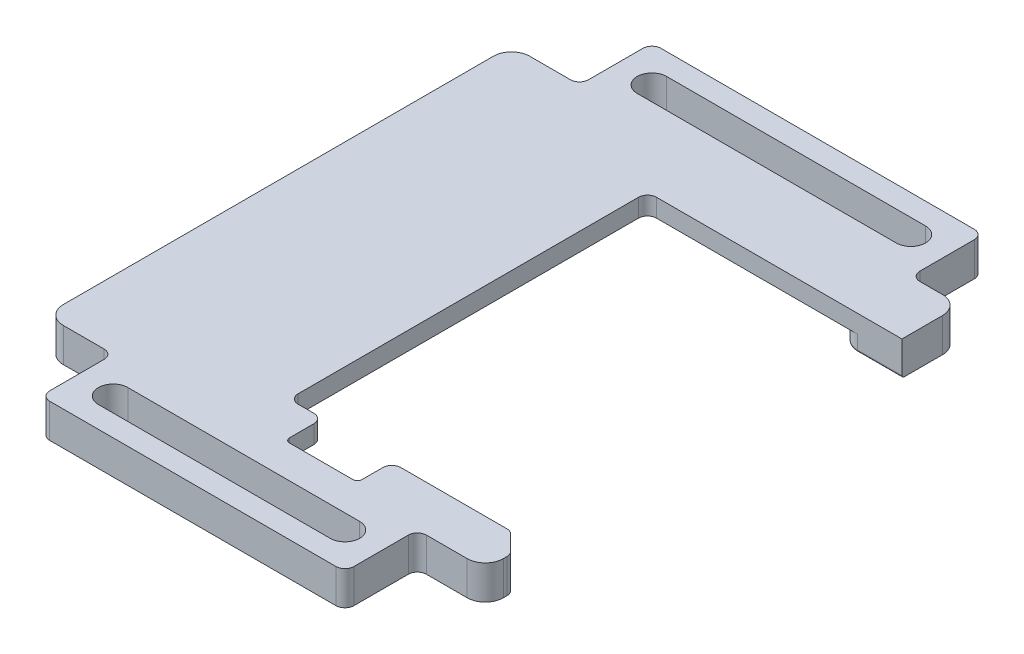
from build123d import *

# Parameters (mm, degrees)
SKETCH1_R           = 2.09
BOSS_EXTRUDE1_DEPTH = 7.5
CUT_EXTRUDE1_DEPTH  = 3.5
BOSS_EXTRUDE2_START = 5.5
SKETCH1_2_R         = 2.09
BOSS_EXTRUDE2_DEPTH = 2
SKETCH3_W           = 67.2
SKETCH3_H           = 16
SKETCH3_W_2         = 73.2
BOSS_EXTRUDE3_DEPTH = 7.5
FILLET11_R          = 4
FILLET10_R          = 4
FILLET7_R           = 0.5
FILLET8_R           = 2
CUT_EXTRUDE2_DEPTH  = 1
CHAMFER1_SIZE       = 4.5
FILLET12_R          = 2


with BuildPart() as part:
    # Sketch1 → Boss-Extrude1 (new body)
    with BuildSketch(Plane(origin=(0, 0, 0), x_dir=(1, 0, 0), z_dir=(0, 1, 0))):
        with BuildLine():
            Line((-10, 98.415579118), (29.043283521, 98.415579118))
            Line((29.043283521, 98.415579118), (75.120827307, 98.415579118))
            Line((75.120827307, 98.415579118), (81.2, 98.415579118))
            ThreePointArc((81.2, 98.415579118), (84.028427125, 97.244006243), (85.2, 94.415579118))
            Line((85.2, 94.415579118), (85.2, 85.44))
            Line((85.2, 85.44), (31, 85.44))
            ThreePointArc((31, 85.44), (29.585786438, 84.854213562), (29, 83.44))
            Line((29, 83.44), (29, 8.281912492))
            ThreePointArc((29, 8.281912492), (29.585786438, 6.86769893), (31, 6.281912492))
            Line((31, 6.281912492), (34.469079788, 6.281912492))
            ThreePointArc((34.469079788, 6.281912492), (35.88329335, 5.696126054), (36.469079788, 4.281912492))
            Line((36.469079788, 4.281912492), (36.469079788, -1.086368588))
            ThreePointArc((36.469079788, -1.086368588), (36.761973007, -1.793475369), (37.469079788, -2.086368588))
            Line((37.469079788, -2.086368588), (51.469079788, -2.086368588))
            ThreePointArc((51.469079788, -2.086368588), (52.176186569, -1.793475369), (52.469079788, -1.086368588))
            Line((52.469079788, -1.086368588), (52.469079788, 3.51))
            ThreePointArc((52.469079788, 3.51), (53.054866225, 4.924213562), (54.469079788, 5.51))
            Line((54.469079788, 5.51), (83.2, 5.51))
            Line((83.2, 5.51), (83.2, -0.586368588))
            ThreePointArc((83.2, -0.586368588), (82.028427125, -3.414795713), (79.2, -4.586368588))
            Line((79.2, -4.586368588), (-10, -4.586368588))
            ThreePointArc((-10, -4.586368588), (-12.828427125, -3.414795713), (-14, -0.586368588))
            Line((-14, -0.586368588), (-14, 94.415579118))
            ThreePointArc((-14, 94.415579118), (-12.828427125, 97.244006243), (-10, 98.415579118))
        make_face()
        with Locations(Location((0, 0, 0), (0, 0, 270))):
            Circle(SKETCH1_R, mode=Mode.SUBTRACT)
        with Locations(Location((0, 91, 0), (0, 0, 270))):
            Circle(SKETCH1_R, mode=Mode.SUBTRACT)
        with Locations(Location((77.7, 91, 0), (0, 0, 270))):
            Circle(SKETCH1_R, mode=Mode.SUBTRACT)
        with Locations(Location((77.7, 0, 0), (0, 0, 270))):
            Circle(SKETCH1_R, mode=Mode.SUBTRACT)
    extrude(amount=BOSS_EXTRUDE1_DEPTH)

    # Sketch2 → Cut-Extrude1 (cut)
    with BuildSketch(Plane.XZ):
        with BuildLine():
            Line((-5.752225656, 0), (-14, 0))
            Line((-14, 0), (-14, -91))
            Line((-14, -91), (-6.873863542, -91))
            ThreePointArc((-6.873863542, -91), (-5.23069587, -90.50998008), (-4.124318125, -89.2))
            ThreePointArc((-4.124318125, -89.2), (0.919393397, -86.594921592), (4.5, -91))
            Line((4.5, -91), (4.5, -93.915579118))
            ThreePointArc((4.5, -93.915579118), (5.085786438, -95.32979268), (6.5, -95.915579118))
            Line((6.5, -95.915579118), (69.376050786, -95.915579118))
            ThreePointArc((69.376050786, -95.915579118), (70.790264348, -95.32979268), (71.376050786, -93.915579118))
            Line((71.376050786, -93.915579118), (71.376050786, 0.086368588))
            ThreePointArc((71.376050786, 0.086368588), (70.790264348, 1.50058215), (69.376050786, 2.086368588))
            Line((69.376050786, 2.086368588), (6.089387528, 2.086368588))
            ThreePointArc((6.089387528, 2.086368588), (4.665181058, 1.490518128), (4.089588668, 0.05800452))
            ThreePointArc((4.089588668, 0.05800452), (4.037618007, -0.652488181), (3.863153191, -1.34318555))
            ThreePointArc((3.863153191, -1.34318555), (0, -4.09), (-3.863153191, -1.34318555))
            ThreePointArc((-3.863153191, -1.34318555), (-4.593266835, -0.370026243), (-5.752225656, 0))
        make_face()
    extrude(amount=-CUT_EXTRUDE1_DEPTH, mode=Mode.SUBTRACT)

    # Sketch1<2> → Boss-Extrude2 (add)
    with BuildSketch(Plane(origin=(0, 0, 0), x_dir=(1, 0, 0), z_dir=(0, 1, 0)).offset(BOSS_EXTRUDE2_START)):
        with Locations(Location((0, 0, 0), (0, 0, 270))):
            Circle(SKETCH1_2_R)
        with Locations(Location((0, 91, 0), (0, 0, 270))):
            Circle(SKETCH1_2_R)
        with Locations(Location((77.7, 91, 0), (0, 0, 270))):
            Circle(SKETCH1_2_R)
        with Locations(Location((77.7, 0, 0), (0, 0, 270))):
            Circle(SKETCH1_2_R)
    extrude(amount=BOSS_EXTRUDE2_DEPTH)

    # Sketch3 → Boss-Extrude3 (add)
    # profile 1 of 2: a face of its own
    with BuildSketch(Plane(origin=(0, 7.5, 0), x_dir=(1, 0, 0), z_dir=(0, 1, 0))):
        with Locations((34.6, -12.586368588)):
            Rectangle(SKETCH3_W, SKETCH3_H)
        with BuildLine():
            Line((60.2, -15.836368588), (9, -15.836368588))
            ThreePointArc((9, -15.836368588), (5.75, -12.586368588), (9, -9.336368588))
            Line((9, -9.336368588), (60.2, -9.336368588))
            ThreePointArc((60.2, -9.336368588), (63.45, -12.586368588), (60.2, -15.836368588))
        make_face(mode=Mode.SUBTRACT)
    # profile 2 of 2: a face of its own
    with BuildSketch(Plane(origin=(0, 7.5, 0), x_dir=(1, 0, 0), z_dir=(0, 1, 0))):
        with Locations((37.6, 106.415579118)):
            Rectangle(SKETCH3_W_2, SKETCH3_H)
        with BuildLine():
            Line((9, 109.665579118), (66.2, 109.665579118))
            ThreePointArc((66.2, 109.665579118), (69.45, 106.415579118), (66.2, 103.165579118))
            Line((66.2, 103.165579118), (9, 103.165579118))
            ThreePointArc((9, 103.165579118), (5.75, 106.415579118), (9, 109.665579118))
        make_face(mode=Mode.SUBTRACT)
    extrude(amount=-BOSS_EXTRUDE3_DEPTH)

    # Fillet11
    fillet11_edges = [part.edges().sort_by_distance(p)[0] for p in [
        (71.376050786, 1.75, -5.51),
    ]]
    fillet(fillet11_edges, radius=FILLET11_R)

    # Fillet10
    fillet10_edges = [part.edges().sort_by_distance(p)[0] for p in [
        (71.376050786, 1.75, -85.44),
    ]]
    fillet(fillet10_edges, radius=FILLET10_R)

    # Fillet7
    fillet7_edges = [part.edges().sort_by_distance(p)[0] for p in [
        (70.790264348, 0, 1.50058215),
        (4.665181058, 0, 1.490518128),
        (0.709684197, 0, -4.027958334),
        (-4.593266835, 0, -0.370026243),
        (-9.876112828, 0, 0),
        (-10.436931771, 0, -91),
        (-5.23069587, 0, -90.50998008),
        (0.919393397, 0, -86.594921592),
        (4.5, 0, -92.457789559),
        (5.085786438, 0, -95.32979268),
        (37.938025393, 0, -95.915579118),
        (70.790264348, 0, -95.32979268),
        (71.376050786, 0, -91.677789559),
        (71.376050786, 0, -0.711815706),
        (72.547623661, 0, -4.338427125),
        (80.288025393, 0, -85.44),
        (72.547623661, 0, -86.611572875),
        (37.732719157, 0, 2.086368588),
        (79.288025393, 0, -5.51),
    ]]
    fillet(fillet7_edges, radius=FILLET7_R)

    # Fillet8
    fillet8_edges = [part.edges().sort_by_distance(p)[0] for p in [
        (68.2, 3.75, 4.586368588),
        (1, 3.75, 4.586368588),
        (1, 3.75, 20.586368588),
        (68.2, 3.75, 20.586368588),
        (74.2, 3.75, -98.415579118),
        (74.2, 3.75, -114.415579118),
        (1, 3.75, -114.415579118),
        (1, 3.75, -98.415579118),
    ]]
    fillet(fillet8_edges, radius=FILLET8_R)

    # Sketch4 → Cut-Extrude2 (cut)
    # profile 1 of 3: a face of its own
    with BuildSketch(Plane.XZ.offset(-3.5)):
        Polygon((7.335777277, -15.119328993), (8.306830963, -15.119328993), (8.306830963, -18.619328993), (7.678625835, -18.619328993), (7.678625835, -15.702662326), (6.960677117, -15.702662326), align=None)
    # profile 2 of 3: a face of its own
    with BuildSketch(Plane.XZ.offset(-3.5)):
        with BuildLine():
            add(Edge.make_bspline(
                [(10.562339777, -15.029585403), (10.592747513, -15.030036814), (10.652537245, -15.03092441), (10.740596266, -15.040537791), (10.825421451, -15.05506093), (10.907344645, -15.075315643), (10.985776157, -15.102122035), (11.061286828, -15.134208827), (11.132977863, -15.173259037), (11.201763551, -15.217368255), (11.267617396, -15.267306142), (11.328956646, -15.324237912), (11.386901488, -15.386853563), (11.440197627, -15.45609973), (11.490025325, -15.531346546), (11.536220855, -15.612605943), (11.578430578, -15.700275632), (11.617127566, -15.794513819), (11.651730535, -15.896733094), (11.680876573, -16.008105956), (11.705874177, -16.12865784), (11.726973919, -16.258688817), (11.742921914, -16.398371729), (11.753671183, -16.547613779), (11.761047841, -16.706127249), (11.761649872, -16.814866186), (11.761959168, -16.870731236)],
                knots=[0, 0, 0, 0, 0.879237366, 1.728815576, 2.559023295, 3.367336655, 4.166867292, 4.954216142, 5.737608147, 6.525189134, 7.316157332, 8.124696809, 8.942788509, 9.781158001, 10.649253743, 11.551476218, 12.482711956, 13.461909668, 14.496590415, 15.601789533, 16.789733467, 18.056700938, 19.410929216, 20.8549011, 22.384193279, 24, 24, 24, 24], degree=3))
            add(Edge.make_bspline(
                [(11.761959168, -16.870731236), (11.761624903, -16.927295221), (11.760975431, -17.037198028), (11.753977833, -17.197161342), (11.741927638, -17.347486979), (11.726396478, -17.488159385), (11.705123037, -17.619104273), (11.68020888, -17.740660704), (11.650602781, -17.852784615), (11.614860001, -17.955223368), (11.576397247, -18.049627058), (11.534072061, -18.137125811), (11.488622167, -18.217956624), (11.441090047, -18.293338938), (11.388869815, -18.361050521), (11.334503179, -18.423393922), (11.275622916, -18.477994399), (11.214708114, -18.527665818), (11.149527218, -18.570591891), (11.08075242, -18.608134327), (11.007157586, -18.638585702), (10.930084224, -18.665070681), (10.848218603, -18.684084038), (10.762861557, -18.699170512), (10.673049422, -18.707508223), (10.611901702, -18.708542571), (10.580568944, -18.709072582)],
                knots=[0, 0, 0, 0, 1.643780988, 3.193836972, 4.651895693, 6.025988579, 7.305620092, 8.505800249, 9.631074763, 10.672816429, 11.65661981, 12.592235626, 13.49536222, 14.350718032, 15.179365177, 15.97804903, 16.751647189, 17.51006938, 18.259804725, 19.016521909, 19.783502495, 20.571750527, 21.382245291, 22.22305063, 23.089471752, 24, 24, 24, 24], degree=3))
            add(Edge.make_bspline(
                [(10.580568944, -18.709072582), (10.549237031, -18.708532348), (10.487858274, -18.707474036), (10.397803278, -18.699232507), (10.311993882, -18.684022923), (10.229480572, -18.66492471), (10.150837629, -18.638644302), (10.075687961, -18.607281844), (10.004609404, -18.569973654), (9.937405153, -18.526947567), (9.874304662, -18.477608488), (9.814327351, -18.422484155), (9.757605892, -18.361714292), (9.705003159, -18.294618228), (9.655657672, -18.222091554), (9.610084027, -18.143306052), (9.568309611, -18.058376431), (9.529027714, -17.967184309), (9.494896718, -17.867766422), (9.464521716, -17.759234984), (9.439639314, -17.640685293), (9.419627221, -17.512155435), (9.403649577, -17.373917708), (9.391764047, -17.225905386), (9.38472758, -17.068049531), (9.38408492, -16.959547338), (9.38375404, -16.903683961)],
                knots=[0, 0, 0, 0, 0.917216111, 1.796812873, 2.643793957, 3.46689424, 4.273913431, 5.068098542, 5.848489301, 6.620921603, 7.401012384, 8.190319798, 9.003608147, 9.831726257, 10.68377682, 11.569763213, 12.493818149, 13.453288342, 14.474581811, 15.568529029, 16.750744269, 18.018426408, 19.375425659, 20.823733699, 22.36466933, 24, 24, 24, 24], degree=3))
            add(Edge.make_bspline(
                [(9.38375404, -16.903683961), (9.384353398, -16.826066195), (9.385509866, -16.676301717), (9.400165487, -16.459935591), (9.42167622, -16.259942587), (9.453270392, -16.076657244), (9.492336149, -15.909400728), (9.542361885, -15.759274836), (9.599312546, -15.624202241), (9.647841826, -15.544184422), (9.671213976, -15.505647102)],
                knots=[0, 0, 0, 0, 1.288568992, 2.486310467, 3.599230591, 4.627010532, 5.572937695, 6.447898582, 7.252493626, 8, 8, 8, 8], degree=3))
            add(Edge.make_bspline(
                [(9.671213976, -15.505647102), (9.698389998, -15.46778805), (9.751524475, -15.393766145), (9.844431595, -15.296589219), (9.944248199, -15.213478753), (10.053024463, -15.146315613), (10.169040046, -15.093350754), (10.293290999, -15.055942271), (10.425318486, -15.034146346), (10.515983963, -15.03112842), (10.562339777, -15.029585403)],
                knots=[0, 0, 0, 0, 1.058512271, 2.069600068, 3.047294572, 4.004278952, 4.967380941, 5.939006123, 6.946246673, 8, 8, 8, 8], degree=3))
        make_face()
        with BuildLine():
            add(Edge.make_bspline(
                [(10.577764456, -15.657790531), (10.550275611, -15.659093448), (10.496382883, -15.661647856), (10.418181966, -15.683331177), (10.344443385, -15.716822237), (10.288352415, -15.75712349), (10.246368882, -15.795757074), (10.217034686, -15.830719212), (10.188746478, -15.869734438), (10.163760908, -15.914563308), (10.140168008, -15.963595069), (10.117110633, -16.017052295), (10.09820964, -16.076248011), (10.079639915, -16.140174108), (10.063371104, -16.21059797), (10.049741407, -16.288095237), (10.03756447, -16.373169879), (10.029070912, -16.465877621), (10.021152366, -16.566121467), (10.015475978, -16.674124722), (10.013102823, -16.789858249), (10.012348469, -16.869562212), (10.011959168, -16.910695179)],
                knots=[0, 0, 0, 0, 1.076674018, 2.110852608, 3.161083442, 4.239746716, 4.804137807, 5.395870207, 6.026861976, 6.692161227, 7.405688833, 8.16177676, 8.973626916, 9.841385931, 10.773283133, 11.807421078, 12.927755683, 14.143907515, 15.458935494, 16.872852025, 18.386167141, 20, 20, 20, 20], degree=3))
            add(Edge.make_bspline(
                [(10.011959168, -16.910695179), (10.01259991, -16.963984926), (10.01382858, -17.066171966), (10.020263779, -17.213120489), (10.033162602, -17.346855478), (10.049206133, -17.468283303), (10.071739927, -17.576616474), (10.097666516, -17.672879922), (10.129683548, -17.755846523), (10.166685398, -17.826716159), (10.207666614, -17.887004811), (10.252153527, -17.938250437), (10.298631517, -17.982626732), (10.348551312, -18.018673049), (10.40179382, -18.046297285), (10.457914563, -18.066167056), (10.516949205, -18.078330171), (10.557375519, -18.080016804), (10.577764456, -18.080867454)],
                knots=[0, 0, 0, 0, 1.771748488, 3.397459088, 4.888034009, 6.237357457, 7.467047327, 8.564189669, 9.548206622, 10.417051504, 11.216568818, 11.965764335, 12.669334354, 13.348544111, 14.005342236, 14.656555988, 15.322436492, 16, 16, 16, 16], degree=3))
            add(Edge.make_bspline(
                [(10.577764456, -18.080867454), (10.59745371, -18.080285376), (10.63600282, -18.07914574), (10.692216055, -18.067447524), (10.745375285, -18.048428766), (10.795320005, -18.021525398), (10.84222886, -17.987313648), (10.885872589, -17.945643177), (10.925922039, -17.896098627), (10.949255031, -17.859329243), (10.961278078, -17.840382679)],
                knots=[0, 0, 0, 0, 0.992283464, 1.942767638, 2.88273346, 3.832339453, 4.79467288, 5.803907806, 6.868395428, 8, 8, 8, 8], degree=3))
            add(Edge.make_bspline(
                [(10.961278078, -17.840382679), (10.975433191, -17.814492804), (11.005115316, -17.760203835), (11.039463521, -17.668593225), (11.068375926, -17.565271598), (11.09326041, -17.449917408), (11.110279879, -17.322075683), (11.124937025, -17.182557078), (11.132006531, -17.030659035), (11.133156425, -16.925423522), (11.13375404, -16.870731236)],
                knots=[0, 0, 0, 0, 0.710965849, 1.490837728, 2.352621235, 3.297892224, 4.334225155, 5.461620853, 6.680770821, 8, 8, 8, 8], degree=3))
            add(Edge.make_bspline(
                [(11.13375404, -16.870731236), (11.133523194, -16.815564195), (11.133078855, -16.709377057), (11.124926528, -16.55693293), (11.11357379, -16.41770052), (11.096968012, -16.291990677), (11.075601659, -16.179498232), (11.049267549, -16.080230539), (11.018221593, -15.99399196), (10.981404788, -15.920868488), (10.940627889, -15.858723567), (10.897341966, -15.805408046), (10.851363989, -15.759888599), (10.802770847, -15.721993928), (10.750437835, -15.693039558), (10.695364582, -15.672595377), (10.637438185, -15.660227333), (10.597924181, -15.658613762), (10.577764456, -15.657790531)],
                knots=[0, 0, 0, 0, 1.793836731, 3.452829483, 4.963243077, 6.335886805, 7.574563692, 8.684454726, 9.672768357, 10.54971625, 11.340229787, 12.085688095, 12.778991901, 13.440269426, 14.083255152, 14.715733572, 15.344777694, 16, 16, 16, 16], degree=3))
        make_face(mode=Mode.SUBTRACT)
    # profile 3 of 3: a face of its own
    with BuildSketch(Plane.XZ.offset(-3.5)):
        Polygon((12.720392662, -15.119328993), (13.691446347, -15.119328993), (13.691446347, -18.619328993), (13.063241219, -18.619328993), (13.063241219, -15.702662326), (12.345292501, -15.702662326), align=None)
    extrude(amount=-CUT_EXTRUDE2_DEPTH, mode=Mode.SUBTRACT)

    # Chamfer1
    # the kernel refuses this chamfer: 4.5 mm, written as the material it takes off along each edge
    with BuildSketch(Plane(origin=(83.2, -11.072573446, -5.51), x_dir=(0.027495876610585245, 0, 0.9996219169112969), z_dir=(0, 1, 0))) as chamfer1_piece_1:
        Polygon((CHAMFER1_SIZE * 0.999621916911, -CHAMFER1_SIZE * 0.0274958766106), (-CHAMFER1_SIZE * 0.0274958766106, -CHAMFER1_SIZE * 0.999621916911), (0, 0), align=None)
    extrude(amount=30.145146892, mode=Mode.SUBTRACT)

    # Fillet12
    # the kernel refuses this fillet: 2 mm, written as the material it takes off along each edge
    with BuildSketch(Plane(origin=(83.2, -2.071067812, -1.01), x_dir=(0, 0, 1), z_dir=(0, 1, 0))) as fillet12_piece_1:
        with BuildLine():
            CenterArc((FILLET12_R * 0.414213562373, -FILLET12_R), FILLET12_R, 90, 45)
            Line((-FILLET12_R * 0.292893218814, -FILLET12_R * 0.292893218814), (0, 0))
            Line((0, 0), (FILLET12_R * 0.414213562373, 0))
        make_face()
    extrude(amount=11.642135624, mode=Mode.SUBTRACT)
    with BuildSketch(Plane(origin=(78.7, -1.571067812, -5.51), x_dir=(0.7071067811868247, 0, 0.7071067811862704), z_dir=(0, 1, 0))) as fillet12_piece_2:
        with BuildLine():
            CenterArc((FILLET12_R * 0.414213562373, -FILLET12_R), FILLET12_R, 90, 45)
            Line((-FILLET12_R * 0.292893218813, -FILLET12_R * 0.292893218813), (0, 0))
            Line((0, 0), (FILLET12_R * 0.414213562373, 0))
        make_face()
    extrude(amount=11.142135624, mode=Mode.SUBTRACT)


solid = part.part
